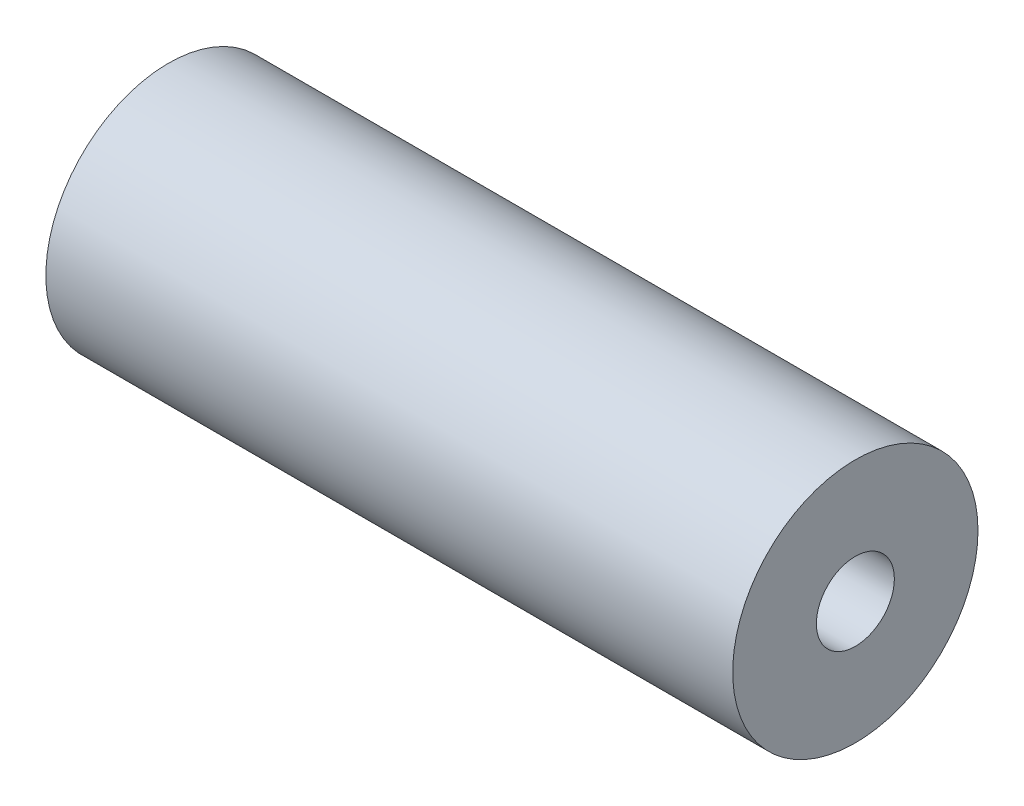
from build123d import *

# Parameters (mm, degrees)
SKETCH1_R           = 6.35
BOSS_EXTRUDE1_DEPTH = 17.78


with BuildPart() as part:
    # Sketch1 → Boss-Extrude1 (new, symmetric)
    with BuildSketch(Plane(origin=(0, 0, 0), x_dir=(0, 0, -1), z_dir=(1, 0, 0))):
        Circle(SKETCH1_R)
    extrude(amount=BOSS_EXTRUDE1_DEPTH, both=True)

    # Sketch4 → Tap Drill for #10-32 Tap1 (revolve, cut)
    with BuildSketch(Plane(origin=(17.78, 0, 0), x_dir=(0, 0, -1), z_dir=(0, 1, 0))):
        Polygon((0, 0), (0, 12.643317848), (2.0193, 11.43), (2.0193, 0), align=None)
    tap_drill_for_10_32_tap1 = revolve(axis=Axis((24.13, 0, 0), (-1, 0, 0)), mode=Mode.SUBTRACT)

    # Mirror1: Tap Drill for #10-32 Tap1 across plane
    add(tap_drill_for_10_32_tap1.mirror(Plane(origin=(0, 0, 0), x_dir=(0, 0, 1), z_dir=(1, 0, 0))), mode=Mode.SUBTRACT)


solid = part.part
